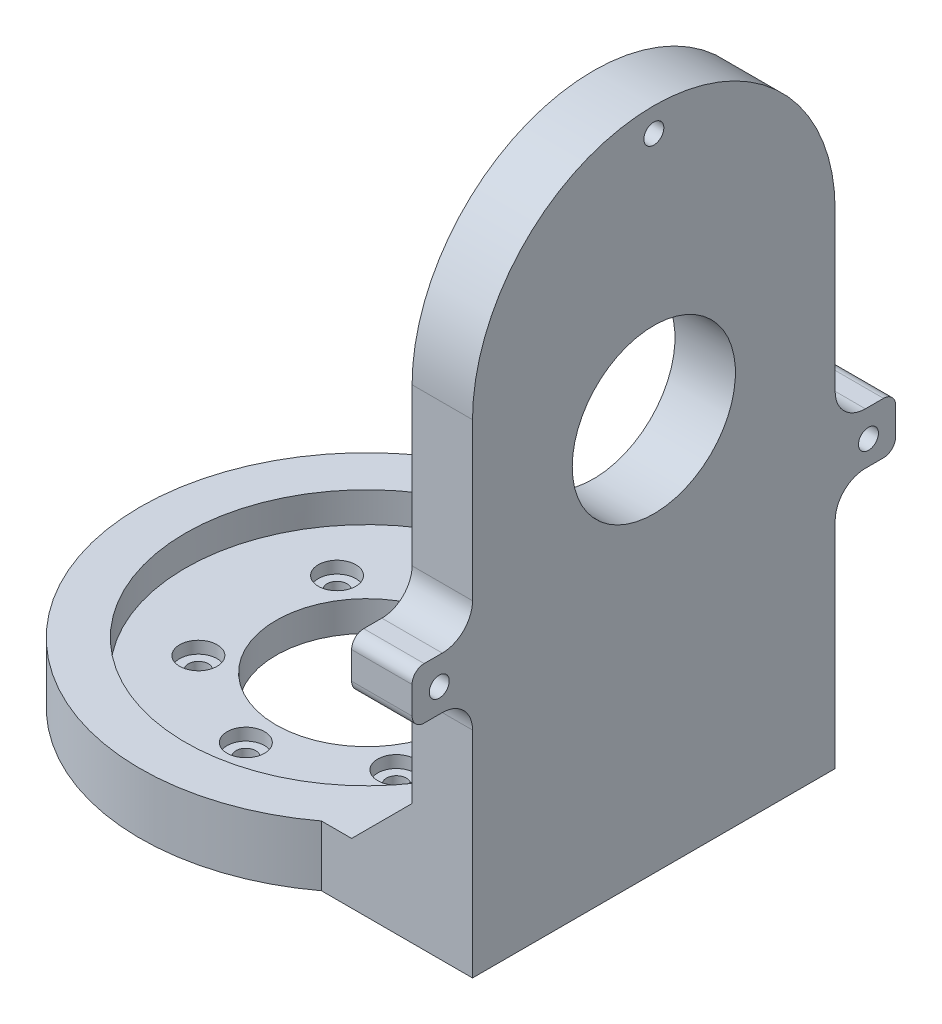
from build123d import *

# Parameters (mm, degrees)
SKETCH1_R           = 37.5
SKETCH1_R_2         = 15
BOSS_EXTRUDE1_DEPTH = 5
SKETCH2_R           = 37.5
SKETCH2_R_2         = 30
BOSS_EXTRUDE2_DEPTH = 5
SKETCH3_R           = 1.65
CUT_EXTRUDE1_DEPTH  = 54.268189382
SKETCH4_R           = 3.1
CUT_EXTRUDE2_DEPTH  = 2
BOSS_EXTRUDE3_DEPTH = 10
SKETCH6_W           = 10
SKETCH6_H           = 60
BOSS_EXTRUDE4_DEPTH = 70
SKETCH7_R           = 13.5
CUT_EXTRUDE3_DEPTH  = 70
BOSS_EXTRUDE6_DEPTH = 10
SKETCH12_W          = 10
SKETCH12_H          = 8.531115437
BOSS_EXTRUDE7_DEPTH = 10
FILLET2_R           = 5
SKETCH10_R          = 1.65
CUT_EXTRUDE5_DEPTH  = 15
CHAMFER1_SIZE       = 10
FILLET3_R           = 2


# Read off the part's stored shape, not the designer's step: Boss-Extrude3
with BuildPart() as part:
    # Sketch1 → Boss-Extrude1 (new body)
    with BuildSketch(Plane(origin=(0, 0, 0), x_dir=(1, 0, 0), z_dir=(0, 1, 0))):
        with Locations(Location((0, 0, 0), (0, 0, 270))):
            Circle(SKETCH1_R)
        with Locations(Location((0, 0, 0), (0, 0, 270))):
            Circle(SKETCH1_R_2, mode=Mode.SUBTRACT)
    extrude(amount=BOSS_EXTRUDE1_DEPTH)

    # Sketch2 → Boss-Extrude2 (add)
    with BuildSketch(Plane(origin=(0, 5, 0), x_dir=(1, 0, 0), z_dir=(0, 1, 0))):
        with Locations(Location((0, 0, 0), (0, 0, 270))):
            Circle(SKETCH2_R)
        with Locations(Location((0, 0, 0), (0, 0, 270))):
            Circle(SKETCH2_R_2, mode=Mode.SUBTRACT)
    extrude(amount=BOSS_EXTRUDE2_DEPTH)

    # Sketch3 → Cut-Extrude1 (cut, through all)
    with BuildSketch(Plane(origin=(0, 5, 0), x_dir=(1, 0, 0), z_dir=(0, 1, 0))):
        with Locations(Location((0, -20, 0), (0, 0, 270))):
            Circle(SKETCH3_R)
        with Locations(Location((16.383040886, -11.471528727, 0), (0, 0, 270))):
            Circle(SKETCH3_R)
        with Locations(Location((-16.383040886, -11.471528727, 0), (0, 0, 270))):
            Circle(SKETCH3_R)
        with Locations(Location((-16.383040886, 11.471528727, 0), (0, 0, 90))):
            Circle(SKETCH3_R)
        with Locations(Location((0, 20, 0), (0, 0, 90))):
            Circle(SKETCH3_R)
        with Locations(Location((16.383040886, 11.471528727, 0), (0, 0, 90))):
            Circle(SKETCH3_R)
    extrude(amount=-CUT_EXTRUDE1_DEPTH, mode=Mode.SUBTRACT)

    # Sketch4 → Cut-Extrude2 (cut)
    with BuildSketch(Plane(origin=(0, 5, 0), x_dir=(1, 0, 0), z_dir=(0, 1, 0))):
        with Locations(Location((0, -20, 0), (0, 0, 270))):
            Circle(SKETCH4_R)
        with Locations(Location((16.383040886, -11.471528727, 0), (0, 0, 270))):
            Circle(SKETCH4_R)
        with Locations(Location((-16.383040886, -11.471528727, 0), (0, 0, 270))):
            Circle(SKETCH4_R)
        with Locations(Location((-16.383040886, 11.471528727, 0), (0, 0, 90))):
            Circle(SKETCH4_R)
        with Locations(Location((16.383040886, 11.471528727, 0), (0, 0, 90))):
            Circle(SKETCH4_R)
        with Locations(Location((0, 20, 0), (0, 0, 90))):
            Circle(SKETCH4_R)
    extrude(amount=-CUT_EXTRUDE2_DEPTH, mode=Mode.SUBTRACT)

    # Boss-Extrude3 outline → Boss-Extrude3 (add)
    with BuildSketch(Plane(origin=(0, 0, 0), x_dir=(1, 0, 0), z_dir=(0, 1, 0))):
        with BuildLine():
            Line((22.5, -30), (47.5, -30))
            Line((47.5, -30), (47.5, 30))
            Line((47.5, 30), (22.5, 30))
            ThreePointArc((22.5, 30), (37.5, 0), (22.5, -30))
        make_face()
    extrude(amount=BOSS_EXTRUDE3_DEPTH)

    # Sketch6 → Boss-Extrude4 (add)
    with BuildSketch(Plane(origin=(0, 10, 0), x_dir=(1, 0, 0), z_dir=(0, 1, 0))):
        with Locations((42.5, 0)):
            Rectangle(SKETCH6_W, SKETCH6_H)
    extrude(amount=BOSS_EXTRUDE4_DEPTH)

    # Sketch7 → Cut-Extrude3 (cut)
    with BuildSketch(Plane.ZY.offset(-37.5)):
        with Locations((0, 65)):
            Circle(SKETCH7_R)
    extrude(amount=-CUT_EXTRUDE3_DEPTH, mode=Mode.SUBTRACT)

    # Sketch9 → Boss-Extrude6 (add)
    with BuildSketch(Plane(origin=(47.5, 0, 0), x_dir=(0, 0, -1), z_dir=(1, 0, 0))):
        with BuildLine():
            ThreePointArc((-30, 80), (0, 110), (30, 80))
            Line((30, 80), (-30, 80))
        make_face()
    extrude(amount=-BOSS_EXTRUDE6_DEPTH)

    # Sketch12 → Boss-Extrude7 (add)
    with BuildSketch(Plane(origin=(47.5, 0, 0), x_dir=(0, 0, -1), z_dir=(1, 0, 0))):
        with Locations((-35, 44.792740579)):
            Rectangle(SKETCH12_W, SKETCH12_H)
        with Locations((35, 44.792740579)):
            Rectangle(SKETCH12_W, SKETCH12_H)
    extrude(amount=-BOSS_EXTRUDE7_DEPTH)

    # Fillet2
    fillet2_edges = [part.edges().sort_by_distance(p)[0] for p in [
        (42.5, 49.058298297, 30),
        (42.5, 40.52718286, 30),
        (42.5, 40.52718286, -30),
        (42.5, 49.058298297, -30),
    ]]
    fillet(fillet2_edges, radius=FILLET2_R)

    # Sketch10 → Cut-Extrude5 (cut)
    with BuildSketch(Plane.ZY.offset(-37.5)):
        with Locations((0, 106)):
            Circle(SKETCH10_R)
        with Locations((35.507041555, 44.5)):
            Circle(SKETCH10_R)
        with Locations((-35.507041555, 44.5)):
            Circle(SKETCH10_R)
    extrude(amount=-CUT_EXTRUDE5_DEPTH, mode=Mode.SUBTRACT)

    # Chamfer1
    # the kernel refuses this chamfer: 10 mm, written as the material it adds along each edge
    with BuildSketch(Plane(origin=(37.5, 10, 30), x_dir=(0.027495876610586317, 0.9996219169112968, 0), z_dir=(0, 0, -1))) as chamfer1_piece_1_section:
        Polygon((CHAMFER1_SIZE * 0.999621916911, -CHAMFER1_SIZE * 0.0274958766106), (-CHAMFER1_SIZE * 0.0274958766106, -CHAMFER1_SIZE * 0.999621916911), (0, 0), align=None)
    chamfer1_piece_1 = extrude(amount=60, mode=Mode.PRIVATE)
    chamfer1_piece_1 = chamfer1_piece_1 - Plane(origin=(0, 13.349530392, 0), x_dir=(0, 0, 1), z_dir=(0, -1, 0)) * Cylinder(30, 160, mode=Mode.PRIVATE)
    add(chamfer1_piece_1)

    # Fillet3
    fillet3_edges = [part.edges().sort_by_distance(p)[0] for p in [
        (42.5, 40.52718286, 40),
        (42.5, 49.058298297, 40),
        (42.5, 49.058298297, -40),
        (42.5, 40.52718286, -40),
    ]]
    fillet(fillet3_edges, radius=FILLET3_R)


solid = part.part
